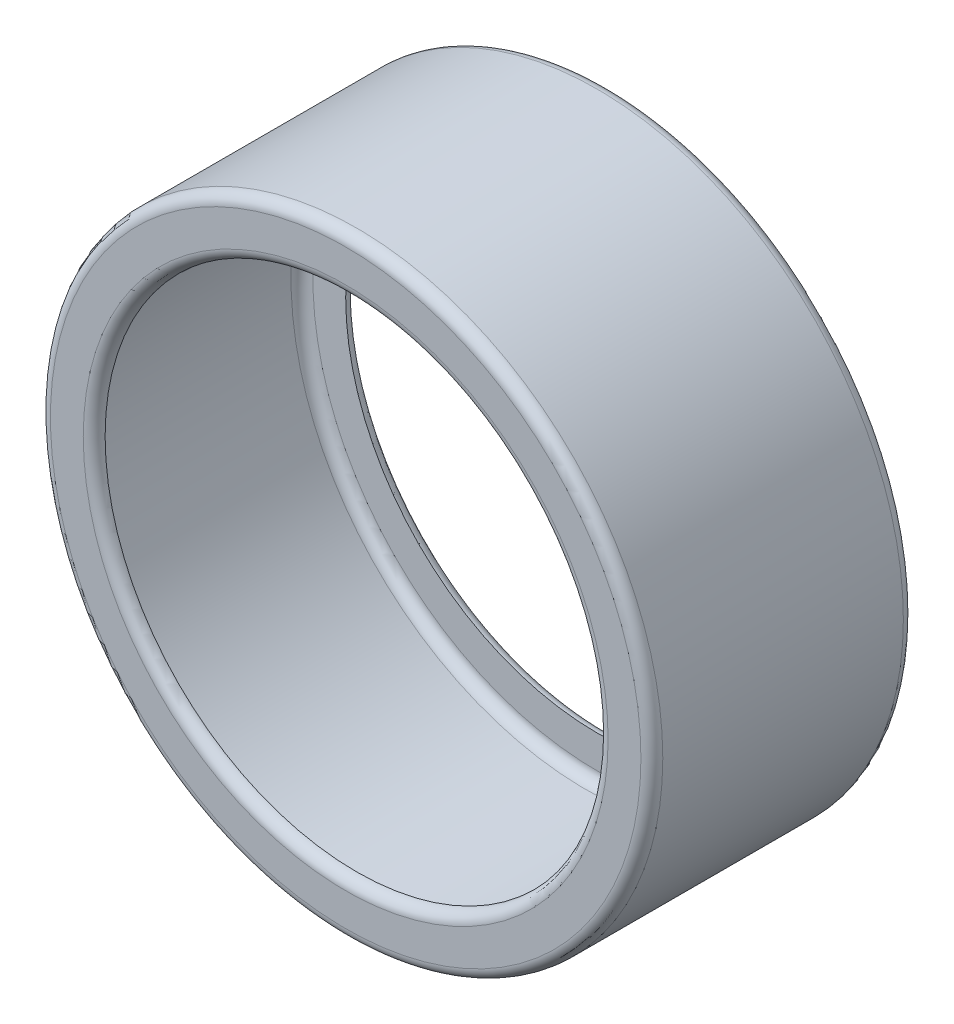
from build123d import *

# Parameters (mm, degrees)
SKETCH1_R           = 28
SKETCH1_R_2         = 23
BOSS_EXTRUDE1_DEPTH = 24
FILLET1_R           = 1
SHELL1_START        = 1
SHELL1_OUTLINE_R    = 27
SHELL1_OUTLINE_R_2  = 23
SHELL1_DEPTH        = 22
FILLET2_R           = 1


# Read off the part's stored shape, not the designer's step: Shell1
with BuildPart() as part:
    # Sketch1 → Boss-Extrude1 (new body)
    with BuildSketch(Plane.XY):
        Circle(SKETCH1_R)
        Circle(SKETCH1_R_2, mode=Mode.SUBTRACT)
    extrude(amount=BOSS_EXTRUDE1_DEPTH)

    # Fillet1
    fillet1_edges = [part.edges().sort_by_distance(p)[0] for p in [
        (-28, 0, 0),
        (-28, 0, 24),
        (-23, 0, 0),
        (-23, 0, 24),
    ]]
    fillet(fillet1_edges, radius=FILLET1_R)

    # Shell1 outline → Shell1 (cut)
    with BuildSketch(Plane.XY.offset(SHELL1_START)):
        Circle(SHELL1_OUTLINE_R)
        Circle(SHELL1_OUTLINE_R_2, mode=Mode.SUBTRACT)
    extrude(amount=SHELL1_DEPTH, mode=Mode.SUBTRACT)

    # Fillet2
    fillet2_edges = [part.edges().sort_by_distance(p)[0] for p in [
        (-27, 0, 23),
        (-27, 0, 1),
    ]]
    fillet(fillet2_edges, radius=FILLET2_R)


solid = part.part
